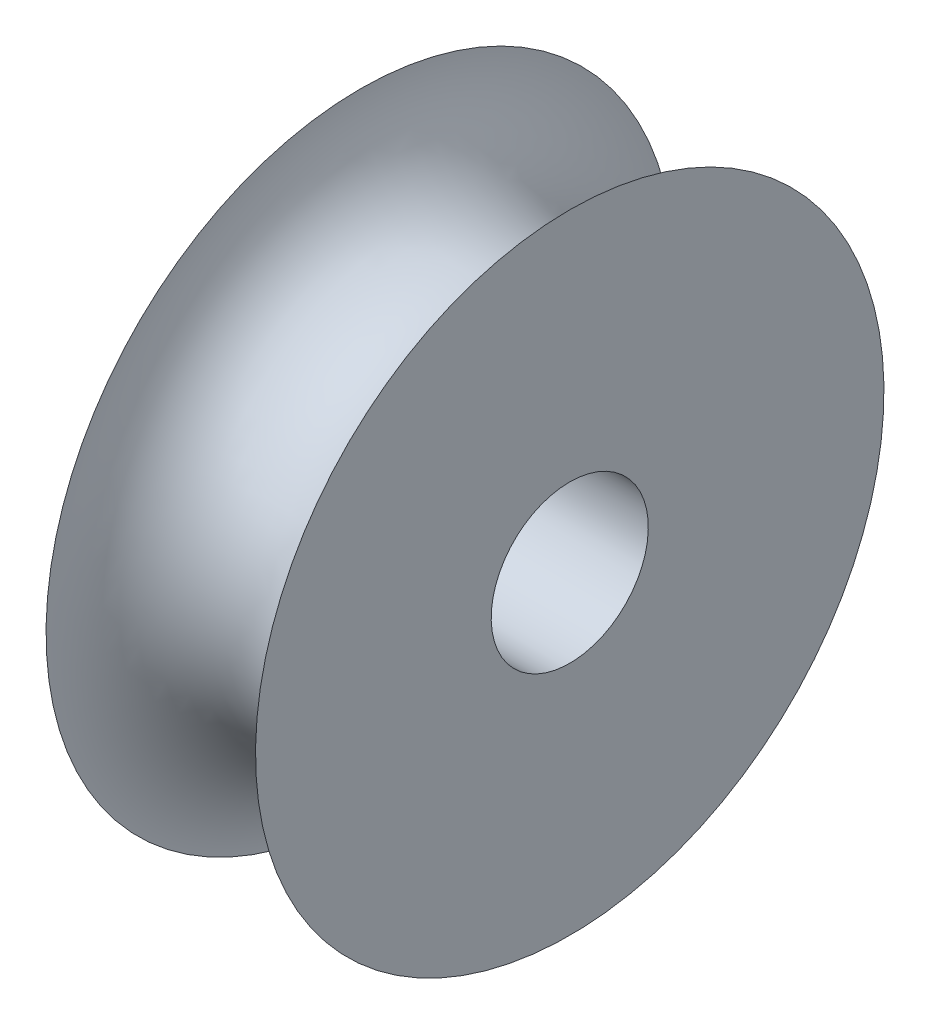
from build123d import *

# Parameters (mm, degrees)
SKIZZE2_R                       = 1.5
SCHNITT_LINEAR_AUSTRAGEN1_DEPTH = 10


with BuildPart() as part:
    # Skizze1 → Rotation1 (revolve)
    with BuildSketch(Plane.XY):
        with BuildLine():
            Line((0, 0), (-4, 0))
            Line((-4, 0), (-4, 6))
            ThreePointArc((-4, 6), (-2, 4), (0, 6))
            Line((0, 6), (0, 0))
        make_face()
    revolve(axis=Axis((0, 0, 0), (-1, 0, 0)))

    # Skizze2 → Schnitt-Linear austragen1 (cut)
    with BuildSketch(Plane(origin=(0, 0, 0), x_dir=(0, 0, -1), z_dir=(1, 0, 0))):
        Circle(SKIZZE2_R)
    extrude(amount=-SCHNITT_LINEAR_AUSTRAGEN1_DEPTH, mode=Mode.SUBTRACT)


solid = part.part
